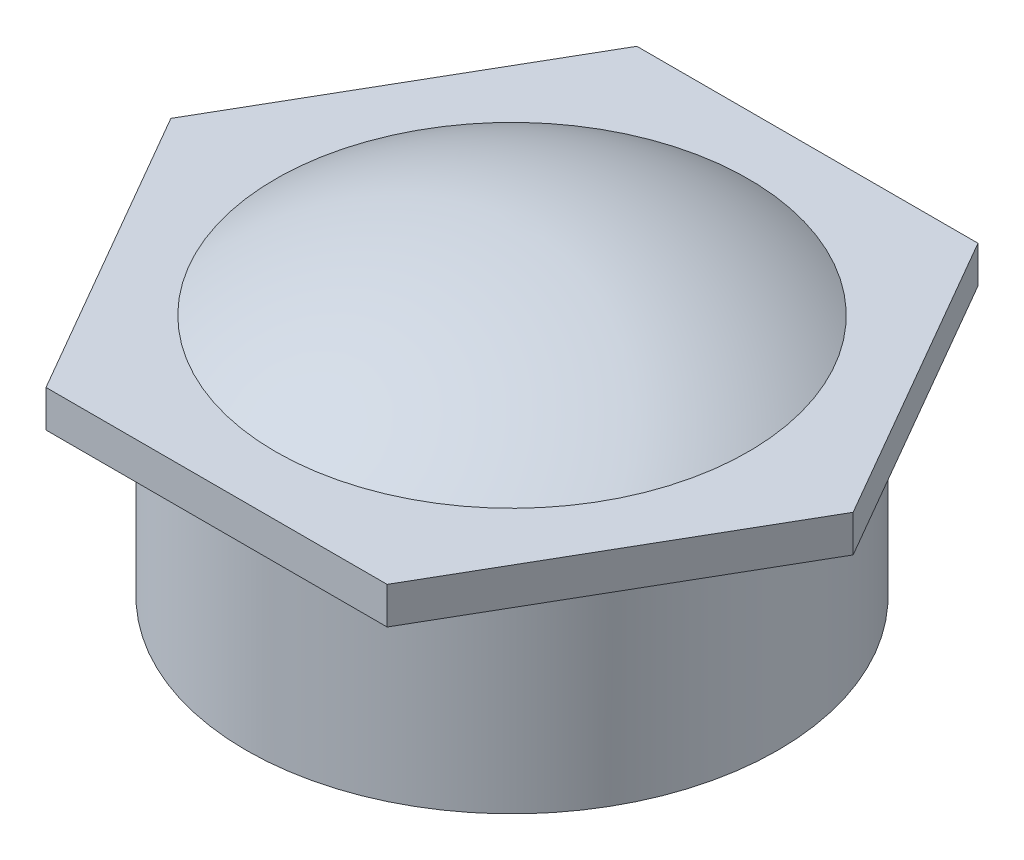
from build123d import *

# Parameters (mm, degrees)
BOSS_EXTRUDE1_DEPTH = 2.5
SKETCH3_R           = 18
SKETCH3_R_2         = 10
BOSS_EXTRUDE2_DEPTH = 14


# Read off the part's stored shape, not the designer's step: Dome1
with BuildPart() as part:
    # Sketch1 → Boss-Extrude1 (new body)
    with BuildSketch(Plane(origin=(0, 0, 0), x_dir=(1, 0, 0), z_dir=(0, 1, 0))):
        Polygon((23.094010768, 0), (11.547005384, 20), (-11.547005384, 20), (-23.094010768, 0), (-11.547005384, -20), (11.547005384, -20), align=None)
    extrude(amount=BOSS_EXTRUDE1_DEPTH)

    # Sketch3 → Boss-Extrude2 (add)
    with BuildSketch(Plane.XZ):
        with Locations(Location((0, 0, 0), (0, 0, 90))):
            Circle(SKETCH3_R)
        with Locations(Location((0, 0, 0), (0, 0, 270))):
            Circle(SKETCH3_R_2, mode=Mode.SUBTRACT)
    extrude(amount=BOSS_EXTRUDE2_DEPTH)

    # Dome1 outline → Dome1 (revolve)
    with BuildSketch(Plane.XY):
        with BuildLine():
            Line((0, 2.499999984), (16.000000023, 2.499999984))
            ThreePointArc((16.000000023, 2.499999984), (8.381527321, 6.220887379), (0, 7.5))
            Line((0, 7.5), (0, 2.499999984))
        make_face()
    revolve(axis=Axis((0, 0, 0), (0, 1, 0)))


solid = part.part
